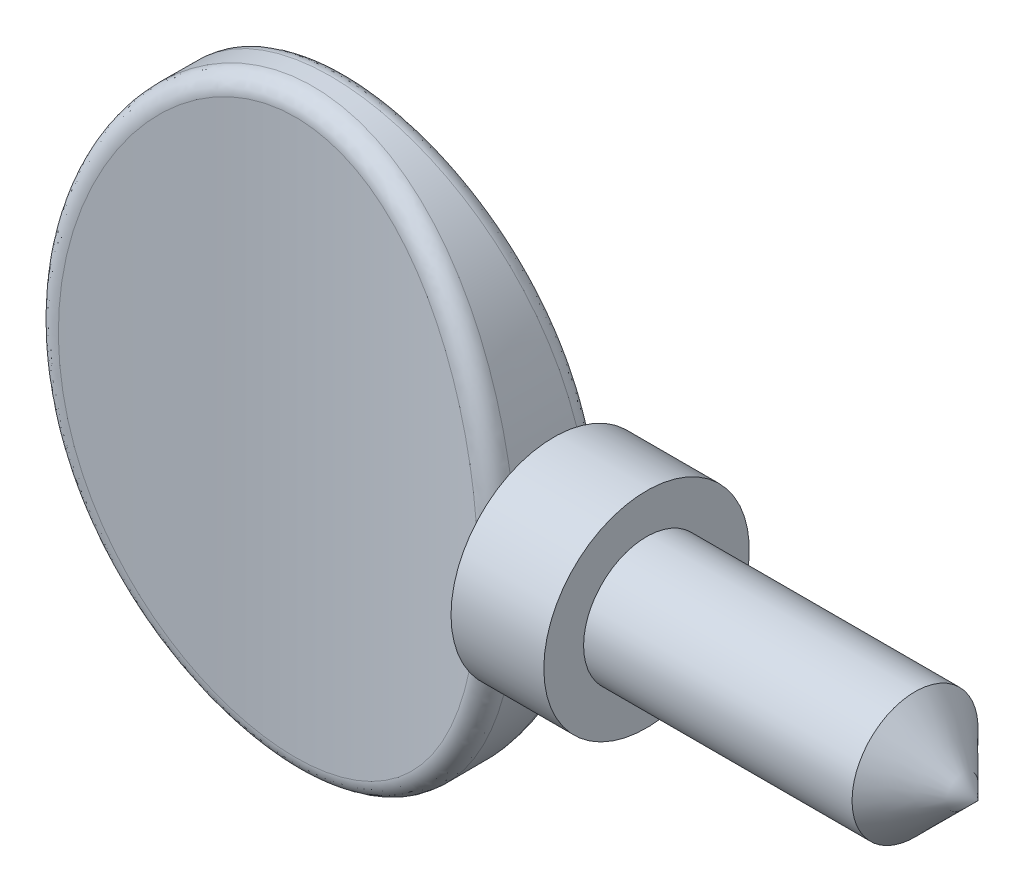
from build123d import *

# Parameters (mm, degrees)
SKETCH1_RX              = 11.303
SKETCH1_RY              = 8.889999999999999
EXTRUDE1_DEPTH          = 2.286
CUT_EXTRUDE1_DEPTH      = 15.560759080487529
CUT_EXTRUDE1_DEPTH_BACK = 15.560759080487529
SKETCH2_OUTSIDE_W       = 25.603999999999996
SKETCH2_OUTSIDE_H       = 12.396
FILLET3_R               = 0.6773333333333333


with BuildPart() as part:
    # Sketch1 → Extrude1 (new, symmetric)
    with BuildSketch(Plane.XY):
        with Locations(Location((0, 0), (0, 0, 90))):
            Ellipse(SKETCH1_RX, SKETCH1_RY)
    extrude(amount=EXTRUDE1_DEPTH, both=True)

    # Sketch2 outside → Cut-Extrude1 (cut, two sides: drawn at the far end of the back side and taken through both)
    with BuildSketch(Plane(origin=(0, 0, 0), x_dir=(1, 0, 0), z_dir=(0, 1, 0)).offset(-CUT_EXTRUDE1_DEPTH_BACK)):
        Rectangle(SKETCH2_OUTSIDE_W, SKETCH2_OUTSIDE_H)
        with BuildLine():
            Line((-8.889999999999999, 2.286), (-8.889999999999999, -2.286))
            ThreePointArc((-8.889999999999999, -2.286), (1.94e-15, -1.0159999999999982), (8.889999999999999, -2.286))
            Line((8.889999999999999, -2.286), (8.889999999999999, 2.286))
            ThreePointArc((8.889999999999999, 2.286), (1.94e-15, 1.0159999999999982), (-8.889999999999999, 2.286))
        make_face(mode=Mode.SUBTRACT)
    extrude(amount=CUT_EXTRUDE1_DEPTH + CUT_EXTRUDE1_DEPTH_BACK, mode=Mode.SUBTRACT)

    # Fillet3
    fillet3_edges = [part.edges().sort_by_distance(p)[0] for p in [
        (-6.499256061e-08, -11.302999999991183, 1.0159999999964504),
        (8.835220095e-08, -11.302999999991183, -1.0159999999964522),
    ]]
    fillet(fillet3_edges, radius=FILLET3_R)

    # Sketch3 → Revolve1 (revolve)
    with BuildSketch(Plane(origin=(0, 0, 0), x_dir=(1, 0, 0), z_dir=(0, 1, 0))):
        with BuildLine():
            Line((12.445999999999996, 3.9369999999999994), (12.445999999999996, 2.413))
            Line((12.445999999999996, 2.413), (22.733000000000008, 2.413))
            Line((22.733000000000008, 2.413), (25.145999999999994, 0))
            Line((25.145999999999994, 0), (7.236423048052516, 0))
            Line((7.236423048052516, 0), (7.236423048052516, 1.8516557328217895))
            ThreePointArc((7.236423048052516, 1.8516557328217895), (8.426438076724871, 2.6063068114075874), (8.889999999999999, 3.9370000000000003))
            Line((8.889999999999999, 3.9370000000000003), (12.445999999999996, 3.9369999999999994))
        make_face()
    revolve(axis=Axis((0, 0, 0), (1, 0, 0)))


solid = part.part
